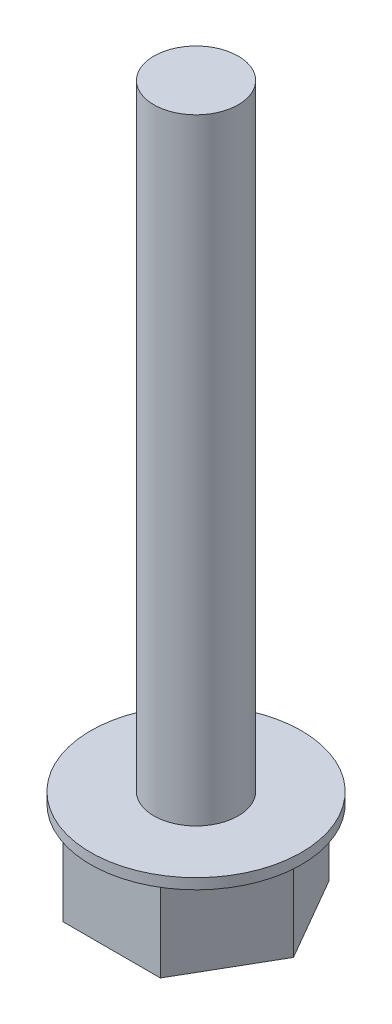
from build123d import *

# Parameters (mm, degrees)
SKETCH1_R           = 3.175
BOSS_EXTRUDE1_DEPTH = 46.355
SKETCH3_R           = 7.9375
BOSS_EXTRUDE3_DEPTH = 0.79375
BOSS_EXTRUDE4_DEPTH = 6.35


# Read off the part's stored shape, not the designer's step: AdvancedHole1
with BuildPart() as part:
    # Sketch1 → Boss-Extrude1 (new body)
    with BuildSketch(Plane(origin=(0, 0, 0), x_dir=(1, 0, 0), z_dir=(0, 1, 0))):
        with Locations(Location((0, 0, 0), (0, 0, 90))):
            Circle(SKETCH1_R)
    extrude(amount=BOSS_EXTRUDE1_DEPTH)

    # Sketch3 → Boss-Extrude3 (add)
    with BuildSketch(Plane.XZ):
        with Locations(Location((0, 0, 0), (0, 0, 270))):
            Circle(SKETCH3_R)
    extrude(amount=BOSS_EXTRUDE3_DEPTH)

    # Sketch4 → Boss-Extrude4 (add)
    with BuildSketch(Plane.XZ.offset(0.79375)):
        Polygon((3.666174209, 6.35), (-3.666174209, 6.35), (-7.332348419, 0), (-3.666174209, -6.35), (3.666174209, -6.35), (7.332348419, 0), align=None)
    extrude(amount=BOSS_EXTRUDE4_DEPTH)

    # AdvancedHole1 outline → AdvancedHole1 (revolve, cut)
    with BuildSketch(Plane.XY):
        Polygon((1.63195, -7.14375), (1.63195, 3.96875), (0, 4.949324487), (0, -7.14375), align=None)
    revolve(axis=Axis((0, 0, 0), (0, 1, 0)), mode=Mode.SUBTRACT)


solid = part.part
